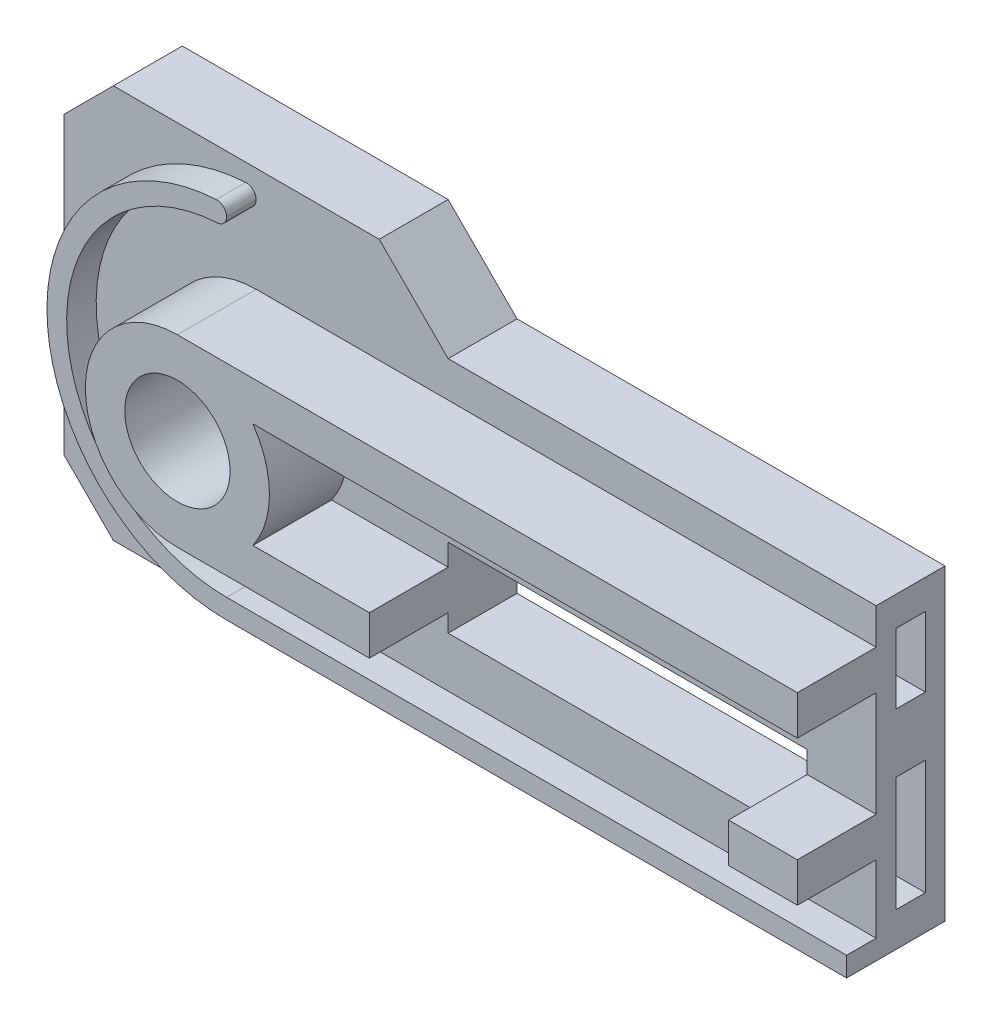
from build123d import *

# Parameters (mm, degrees)
SKETCH1_R               = 5.35
BOSS_EXTRUDE2_DEPTH     = 7
BOSS_EXTRUDE3_START     = 8
SKETCH3_R               = 5.35
BOSS_EXTRUDE3_DEPTH     = 8
BOSS_EXTRUDE4_DEPTH     = 3
FILLET1_R               = 1
CHAMFER1_SIZE           = 10
CHAMFER2_SIZE           = 5
CUT_EXTRUDE1_DEPTH      = 67.560662475
CUT_EXTRUDE1_DEPTH_BACK = 67.560662475
SKETCH5_W               = 36.474956737
SKETCH5_H               = 3.5
SKETCH5_H_2             = 8
CHAMFER3_SIZE           = 7
SKETCH6_W               = 3
SKETCH6_H               = 7.094956055
SKETCH6_H_2             = 11.655043945
CUT_EXTRUDE2_DEPTH      = 3


# Some blends are built 0.0001 mm under size
with BuildPart() as part:
    # Sketch1 → Boss-Extrude2 (new body)
    with BuildSketch(Plane.XY):
        Polygon((-19.503784034, -20), (19.503784034, -20), (19.503784034, -18.25), (62.978740771, -18.25), (62.978740771, 13), (19.503784034, 13), (19.503784034, 20), (-19.503784034, 20), align=None)
        Circle(SKETCH1_R, mode=Mode.SUBTRACT)
    extrude(amount=-BOSS_EXTRUDE2_DEPTH)

    # Sketch3 → Boss-Extrude3 (add)
    with BuildSketch(Plane.XY.offset(BOSS_EXTRUDE3_START)):
        with BuildLine():
            Line((7.668115805, 5.35), (62.978740771, 5.35))
            Line((62.978740771, 5.35), (62.978740771, 9.35))
            Line((62.978740771, 9.35), (0, 9.35))
            ThreePointArc((0, 9.35), (-9.35, 0), (0, -9.35))
            Line((0, -9.35), (62.978740771, -9.35))
            Line((62.978740771, -9.35), (62.978740771, -5.35))
            Line((62.978740771, -5.35), (7.668115805, -5.35))
            ThreePointArc((7.668115805, -5.35), (9.35, 0), (7.668115805, 5.35))
        make_face()
        Circle(SKETCH3_R, mode=Mode.SUBTRACT)
    extrude(amount=-BOSS_EXTRUDE3_DEPTH)

    # Sketch4 → Boss-Extrude4 (add)
    with BuildSketch(Plane.XY):
        with BuildLine():
            Line((0, -18.25), (62.978740771, -18.25))
            Line((62.978740771, -18.25), (62.978740771, -16.25))
            Line((62.978740771, -16.25), (8.306623863, -16.25))
            Line((8.306623863, -16.25), (0, -16.25))
            ThreePointArc((0, -16.25), (-16.25, 0), (0, 16.25))
            Line((0, 16.25), (0, 18.25))
            ThreePointArc((0, 18.25), (-18.25, 0), (0, -18.25))
        make_face()
    extrude(amount=BOSS_EXTRUDE4_DEPTH)

    # Fillet1
    fillet1_edges = [part.edges().sort_by_distance(p)[0] for p in [
        (0, 16.25, 1.5),
        (0, 18.25, 1.5),
    ]]
    fillet(fillet1_edges, radius=FILLET1_R - 0.0001)  # a hair under: the kernel refuses the full size

    # Chamfer1
    # the kernel refuses this chamfer: 10 mm, written as the material it takes off along each edge
    with BuildSketch(Plane(origin=(19.503784034, -20, 25.71682988), x_dir=(0.027495876610586317, 0.9996219169112968, 0), z_dir=(0, 0, -1))) as chamfer1_piece_1_section:
        Polygon((CHAMFER1_SIZE * 0.999621916911, -CHAMFER1_SIZE * 0.0274958766106), (-CHAMFER1_SIZE * 0.0274958766106, -CHAMFER1_SIZE * 0.999621916911), (0, 0), align=None)
    chamfer1_piece_1 = extrude(amount=58.433659759, mode=Mode.PRIVATE)
    chamfer1_piece_1 = split(chamfer1_piece_1, bisect_by=Plane(origin=(14.814200223, -18.25, -3.5), z_dir=(0, -1, 0)), keep=Keep.TOP, mode=Mode.PRIVATE)
    add(chamfer1_piece_1, mode=Mode.SUBTRACT)

    # Chamfer2
    chamfer2_edges = [part.edges().sort_by_distance(p)[0] for p in [
        (-19.503784034, -20, -3.5),
        (-19.503784034, 20, -3.5),
    ]]
    chamfer(chamfer2_edges, length=CHAMFER2_SIZE)

    # Sketch5 → Cut-Extrude1 (cut, two sides: drawn at the far end of the back side and taken through both)
    with BuildSketch(Plane.XY.offset(-CUT_EXTRUDE1_DEPTH_BACK)):
        with Locations((37.741262403, 3.6)):
            Rectangle(SKETCH5_W, SKETCH5_H)
        with Locations((37.741262403, -7.15)):
            Rectangle(SKETCH5_W, SKETCH5_H_2)
    extrude(amount=CUT_EXTRUDE1_DEPTH + CUT_EXTRUDE1_DEPTH_BACK, mode=Mode.SUBTRACT)

    # Chamfer3
    chamfer3_edges = [part.edges().sort_by_distance(p)[0] for p in [
        (19.503784034, 20, -3.5),
    ]]
    chamfer(chamfer3_edges, length=CHAMFER3_SIZE - 0.0001)  # a hair under: the kernel refuses the full size

    # Sketch6 → Cut-Extrude2 (cut)
    with BuildSketch(Plane(origin=(62.978740771, 0, 0), x_dir=(0, 0, -1), z_dir=(1, 0, 0))):
        with Locations((3.5, 6.452521972)):
            Rectangle(SKETCH6_W, SKETCH6_H)
        with Locations((3.5, -8.922478028)):
            Rectangle(SKETCH6_W, SKETCH6_H_2)
    extrude(amount=-CUT_EXTRUDE2_DEPTH, mode=Mode.SUBTRACT)


solid = part.part
